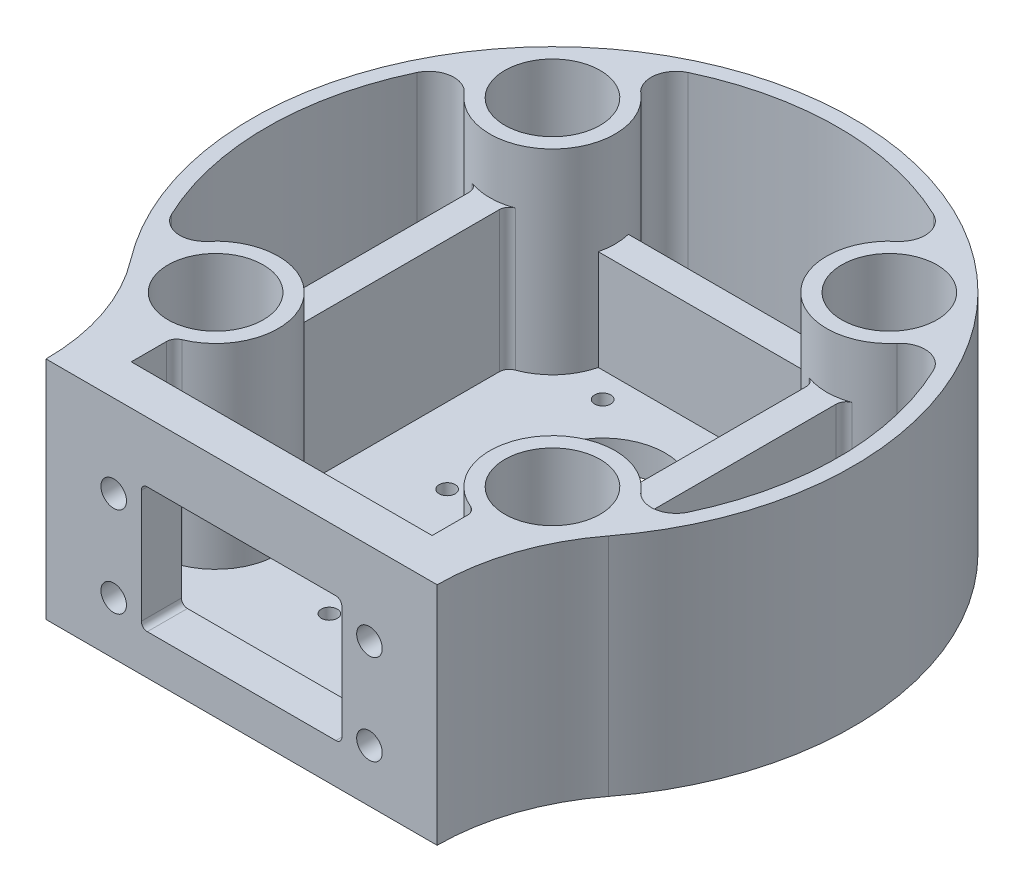
from build123d import *

# Parameters (mm, degrees)
SKETCH1_R           = 9.5
BOSS_EXTRUDE1_DEPTH = 45
BOSS_EXTRUDE2_DEPTH = 6
SKETCH3_R           = 5.25
SKETCH3_R_2         = 4.25
SKETCH3_R_3         = 1.6
CUT_EXTRUDE1_DEPTH  = 95.683683917
FILLET1_R           = 5
SKETCH4_R           = 5.1
CUT_EXTRUDE2_DEPTH  = 2
SKETCH5_R           = 12.5
SKETCH5_R_2         = 1.6
CUT_EXTRUDE3_DEPTH  = 98.308787031
CUT_EXTRUDE4_REACH  = 145.21
SKETCH6_W           = 40
SKETCH6_H           = 25
CUT_EXTRUDE5_REACH  = 145.21
SKETCH7_R           = 2.55
BOSS_EXTRUDE3_DEPTH = 28
FILLET2_R           = 2
BOSS_EXTRUDE4_DEPTH = 20
FILLET3_R           = 1.2


with BuildPart() as part:
    # Sketch1 → Boss-Extrude1 (new body)
    with BuildSketch(Plane(origin=(0, 0, 0), x_dir=(1, 0, 0), z_dir=(0, 1, 0))):
        with BuildLine():
            ThreePointArc((-47.647058368, -36.465844689), (-41.21916632, -48.520286728), (-39, -62))
            Line((-39, -62), (39, -62))
            ThreePointArc((39, -62), (41.21916632, -48.520286728), (47.647058368, -36.465844689))
            ThreePointArc((47.647058368, -36.465844689), (0, 60), (-47.647058368, -36.465844689))
        make_face()
        with Locations((-33.587572106, -33.587572106)):
            Circle(SKETCH1_R, mode=Mode.SUBTRACT)
        with Locations((33.587572106, -33.587572106)):
            Circle(SKETCH1_R, mode=Mode.SUBTRACT)
        with BuildLine():
            Line((30, -54), (-30, -54))
            Line((-30, -54), (-30, -45.561682778))
            ThreePointArc((-30, -45.561682778), (-26.105156211, -23.574408152), (-46.087482283, -33.540184508))
            ThreePointArc((-46.087482283, -33.540184508), (-57, 0), (-46.087482283, 33.540184508))
            ThreePointArc((-46.087482283, 33.540184508), (-24.748737342, 24.748737342), (-33.540184508, 46.087482283))
            ThreePointArc((-33.540184508, 46.087482283), (0, 57), (33.540184508, 46.087482283))
            ThreePointArc((33.540184508, 46.087482283), (24.748737342, 24.748737342), (46.087482283, 33.540184508))
            ThreePointArc((46.087482283, 33.540184508), (57, 0), (46.087482283, -33.540184508))
            ThreePointArc((46.087482283, -33.540184508), (26.105156211, -23.574408152), (30, -45.561682778))
            Line((30, -45.561682778), (30, -54))
        make_face(mode=Mode.SUBTRACT)
        with Locations((-33.587572106, 33.587572106)):
            Circle(SKETCH1_R, mode=Mode.SUBTRACT)
        with Locations((33.587572106, 33.587572106)):
            Circle(SKETCH1_R, mode=Mode.SUBTRACT)
    extrude(amount=BOSS_EXTRUDE1_DEPTH)

    # Sketch2 → Boss-Extrude2 (add)
    with BuildSketch(Plane.XZ):
        with BuildLine():
            Line((39, 62), (-39, 62))
            ThreePointArc((-39, 62), (-41.21916632, 48.520286728), (-47.647058368, 36.465844689))
            ThreePointArc((-47.647058368, 36.465844689), (0, -60), (47.647058368, 36.465844689))
            ThreePointArc((47.647058368, 36.465844689), (41.21916632, 48.520286728), (39, 62))
        make_face()
    extrude(amount=-BOSS_EXTRUDE2_DEPTH)

    # Sketch3 → Cut-Extrude1 (cut, through all)
    with BuildSketch(Plane(origin=(0, 6, 0), x_dir=(1, 0, 0), z_dir=(0, 1, 0))):
        with Locations((-33.587572106, 33.587572106)):
            Circle(SKETCH3_R)
        with Locations((33.587572106, 33.587572106)):
            Circle(SKETCH3_R)
        with Locations((33.587572106, -33.587572106)):
            Circle(SKETCH3_R)
        with Locations((-33.587572106, -33.587572106)):
            Circle(SKETCH3_R)
        with Locations((0, -33)):
            Circle(SKETCH3_R_2)
        with Locations((-5.75, -27.25)):
            Circle(SKETCH3_R_3)
        with Locations((5.75, -27.25)):
            Circle(SKETCH3_R_3)
        with Locations((5.75, -38.75)):
            Circle(SKETCH3_R_3)
        with Locations((-5.75, -38.75)):
            Circle(SKETCH3_R_3)
    extrude(amount=-CUT_EXTRUDE1_DEPTH, mode=Mode.SUBTRACT)

    # Fillet1
    fillet1_edges = [part.edges().sort_by_distance(p)[0] for p in [
        (-46.087482283, 25.5, 33.540184508),
        (46.087482283, 25.5, 33.540184508),
        (46.087482283, 25.5, -33.540184508),
        (33.540184508, 25.5, -46.087482283),
        (-33.540184508, 25.5, -46.087482283),
        (-46.087482283, 25.5, -33.540184508),
    ]]
    fillet(fillet1_edges, radius=FILLET1_R)

    # Sketch4 → Cut-Extrude2 (cut)
    with BuildSketch(Plane(origin=(0, 6, 0), x_dir=(1, 0, 0), z_dir=(0, 1, 0))):
        with Locations((0, -33)):
            Circle(SKETCH4_R)
    extrude(amount=-CUT_EXTRUDE2_DEPTH, mode=Mode.SUBTRACT)

    # Sketch5 → Cut-Extrude3 (cut, through all)
    with BuildSketch(Plane.XZ):
        with Locations((0, -10)):
            Circle(SKETCH5_R)
        with Locations((15.5, 5.5)):
            Circle(SKETCH5_R_2)
        with Locations((-15.5, 5.5)):
            Circle(SKETCH5_R_2)
        with Locations((-15.5, -25.5)):
            Circle(SKETCH5_R_2)
        with Locations((15.5, -25.5)):
            Circle(SKETCH5_R_2)
    extrude(amount=-CUT_EXTRUDE3_DEPTH, mode=Mode.SUBTRACT)

    # Sketch6 → Cut-Extrude4 (cut, up to next)
    with BuildSketch(Plane.XY.offset(62), mode=Mode.PRIVATE) as cut_extrude4_sk1:
        with Locations((0, 20.5)):
            Rectangle(SKETCH6_W, SKETCH6_H)
    cut_extrude4_tool1 = extrude(cut_extrude4_sk1.sketch, amount=-CUT_EXTRUDE4_REACH, mode=Mode.PRIVATE) & part.part
    add(cut_extrude4_tool1.solids().sort_by_distance((0, 20.5, 62))[0], mode=Mode.SUBTRACT)

    # Sketch7 → Cut-Extrude5 (cut, up to next)
    with BuildSketch(Plane.XY.offset(62), mode=Mode.PRIVATE) as cut_extrude5_sk1:
        with Locations((-25.5, 10.5)):
            Circle(SKETCH7_R)
    cut_extrude5_tool1 = extrude(cut_extrude5_sk1.sketch, amount=-CUT_EXTRUDE5_REACH, mode=Mode.PRIVATE) & part.part
    # Sketch7 → Cut-Extrude5 (cut, up to next)
    with BuildSketch(Plane.XY.offset(62), mode=Mode.PRIVATE) as cut_extrude5_sk2:
        with Locations((25.5, 10.5)):
            Circle(SKETCH7_R)
    cut_extrude5_tool2 = extrude(cut_extrude5_sk2.sketch, amount=-CUT_EXTRUDE5_REACH, mode=Mode.PRIVATE) & part.part
    # Sketch7 → Cut-Extrude5 (cut, up to next)
    with BuildSketch(Plane.XY.offset(62), mode=Mode.PRIVATE) as cut_extrude5_sk3:
        with Locations((25.5, 28.5)):
            Circle(SKETCH7_R)
    cut_extrude5_tool3 = extrude(cut_extrude5_sk3.sketch, amount=-CUT_EXTRUDE5_REACH, mode=Mode.PRIVATE) & part.part
    # Sketch7 → Cut-Extrude5 (cut, up to next)
    with BuildSketch(Plane.XY.offset(62), mode=Mode.PRIVATE) as cut_extrude5_sk4:
        with Locations((-25.5, 28.5)):
            Circle(SKETCH7_R)
    cut_extrude5_tool4 = extrude(cut_extrude5_sk4.sketch, amount=-CUT_EXTRUDE5_REACH, mode=Mode.PRIVATE) & part.part
    add(cut_extrude5_tool1.solids().sort_by_distance((-25.5, 10.5, 62))[0], mode=Mode.SUBTRACT)
    add(cut_extrude5_tool2.solids().sort_by_distance((25.5, 10.5, 62))[0], mode=Mode.SUBTRACT)
    add(cut_extrude5_tool3.solids().sort_by_distance((25.5, 28.5, 62))[0], mode=Mode.SUBTRACT)
    add(cut_extrude5_tool4.solids().sort_by_distance((-25.5, 28.5, 62))[0], mode=Mode.SUBTRACT)

    # Sketch8 → Boss-Extrude3 (add)
    with BuildSketch(Plane(origin=(0, 6, 0), x_dir=(1, 0, 0), z_dir=(0, 1, 0))):
        with BuildLine():
            Line((-36.587572106, 21.452911007), (-36.587572106, -21.452911007))
            ThreePointArc((-36.587572106, -21.452911007), (-33.587572106, -21.087572106), (-30.587572106, -21.452911007))
            Line((-30.587572106, -21.452911007), (-30.587572106, 21.452911007))
            ThreePointArc((-30.587572106, 21.452911007), (-33.587572106, 21.087572106), (-36.587572106, 21.452911007))
        make_face()
        with BuildLine():
            Line((30.587572106, 21.452911007), (30.587572106, -21.452911007))
            ThreePointArc((30.587572106, -21.452911007), (33.587572106, -21.087572106), (36.587572106, -21.452911007))
            Line((36.587572106, -21.452911007), (36.587572106, 21.452911007))
            ThreePointArc((36.587572106, 21.452911007), (33.587572106, 21.087572106), (30.587572106, 21.452911007))
        make_face()
    extrude(amount=BOSS_EXTRUDE3_DEPTH)

    # Fillet2
    fillet2_edges = [part.edges().sort_by_distance(p)[0] for p in [
        (36.587572106, 20, 21.452911007),
        (30.587572106, 20, 21.452911007),
        (-36.587572106, 20, 21.452911007),
        (-30.587572106, 20, 21.452911007),
        (30.587572106, 20, -21.452911007),
        (36.587572106, 20, -21.452911007),
        (-36.587572106, 20, -21.452911007),
        (-30.587572106, 20, -21.452911007),
        (30, 25.5, 45.561682778),
        (-30, 25.5, 45.561682778),
    ]]
    fillet(fillet2_edges, radius=FILLET2_R)

    # Sketch9 → Boss-Extrude4 (add)
    with BuildSketch(Plane(origin=(0, 6, 0), x_dir=(1, 0, 0), z_dir=(0, 1, 0))):
        with BuildLine():
            Line((-21.452911007, 30.587572106), (21.452911007, 30.587572106))
            ThreePointArc((21.452911007, 30.587572106), (21.087572106, 33.587572106), (21.452911007, 36.587572106))
            Line((21.452911007, 36.587572106), (-21.452911007, 36.587572106))
            ThreePointArc((-21.452911007, 36.587572106), (-21.087572106, 33.587572106), (-21.452911007, 30.587572106))
        make_face()
    extrude(amount=BOSS_EXTRUDE4_DEPTH)

    # Fillet3
    fillet3_edges = [part.edges().sort_by_distance(p)[0] for p in [
        (20, 8, 58),
        (20, 33, 58),
        (-20, 8, 58),
        (-20, 33, 58),
    ]]
    fillet(fillet3_edges, radius=FILLET3_R)


solid = part.part
